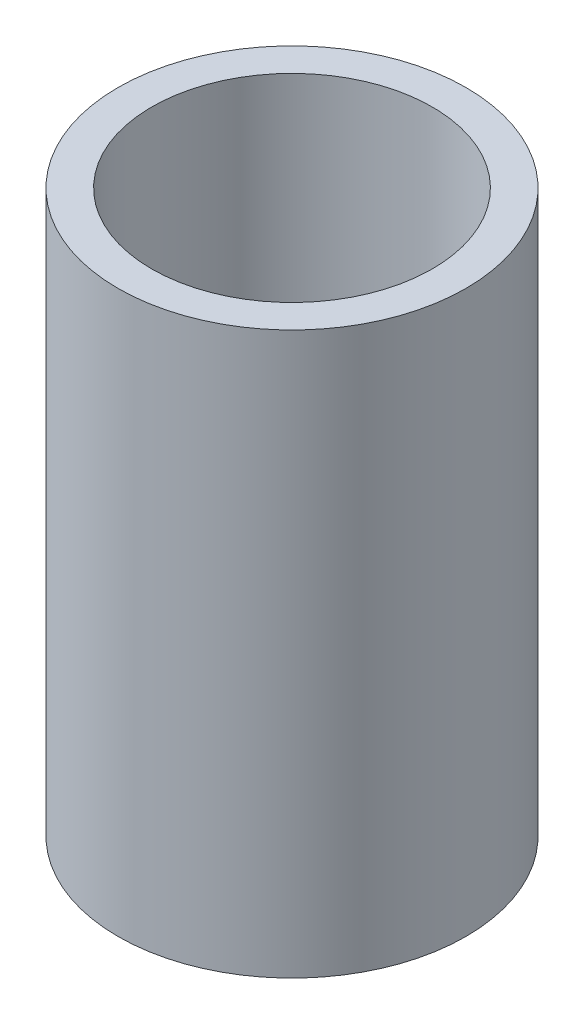
from build123d import *

# Parameters (mm, degrees)
SKETCH1_R           = 15.748
SKETCH1_R_2         = 12.7
BOSS_EXTRUDE1_DEPTH = 50.8


with BuildPart() as part:
    # Sketch1 → Boss-Extrude1 (new body)
    with BuildSketch(Plane(origin=(0, 0, 0), x_dir=(1, 0, 0), z_dir=(0, 1, 0))):
        Circle(SKETCH1_R)
        Circle(SKETCH1_R_2, mode=Mode.SUBTRACT)
    extrude(amount=BOSS_EXTRUDE1_DEPTH)


solid = part.part
